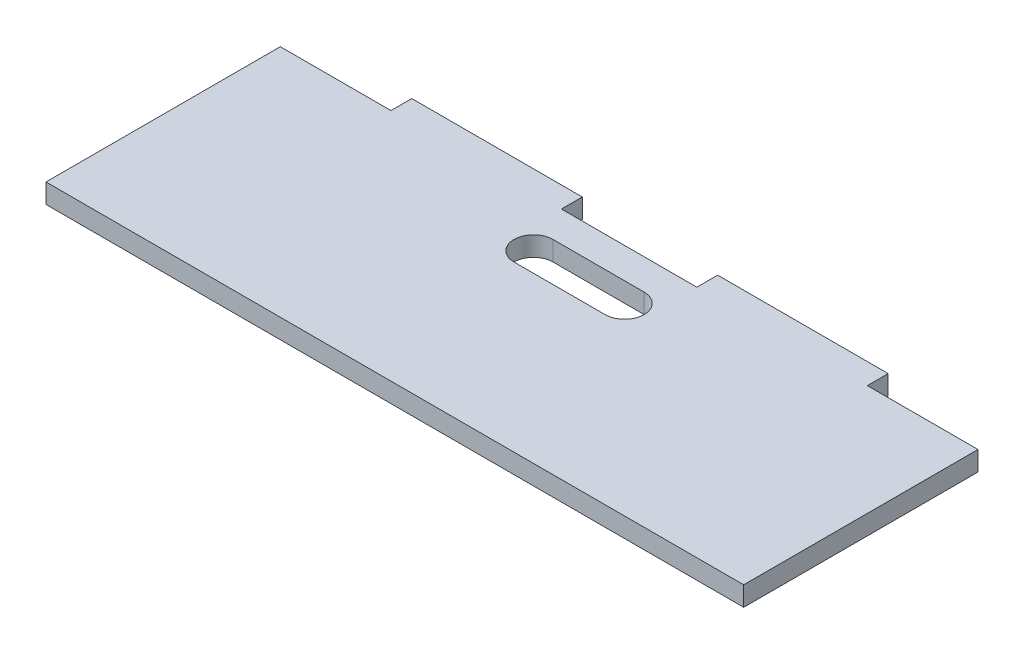
from build123d import *

# Parameters (mm, degrees)
BOSS_EXTRUDE1_DEPTH = 1.5


with BuildPart() as part:
    # Sketch1 → Boss-Extrude1 (new body)
    with BuildSketch(Plane(origin=(0, 0, 0), x_dir=(1, 0, 0), z_dir=(0, 1, 0))):
        Polygon((0, 18), (8.5, 18), (8.5, 19.6), (21.6, 19.6), (21.6, 18), (32, 18), (32, 19.6), (45.1, 19.6), (45.1, 18), (53.6, 18), (53.6, 0), (0, 0), align=None)
        with BuildLine():
            Line((23.3, 15.65), (30.3, 15.65))
            ThreePointArc((30.3, 15.65), (31.8, 14.15), (30.3, 12.65))
            Line((30.3, 12.65), (23.3, 12.65))
            ThreePointArc((23.3, 12.65), (21.8, 14.15), (23.3, 15.65))
        make_face(mode=Mode.SUBTRACT)
    extrude(amount=BOSS_EXTRUDE1_DEPTH)


solid = part.part
